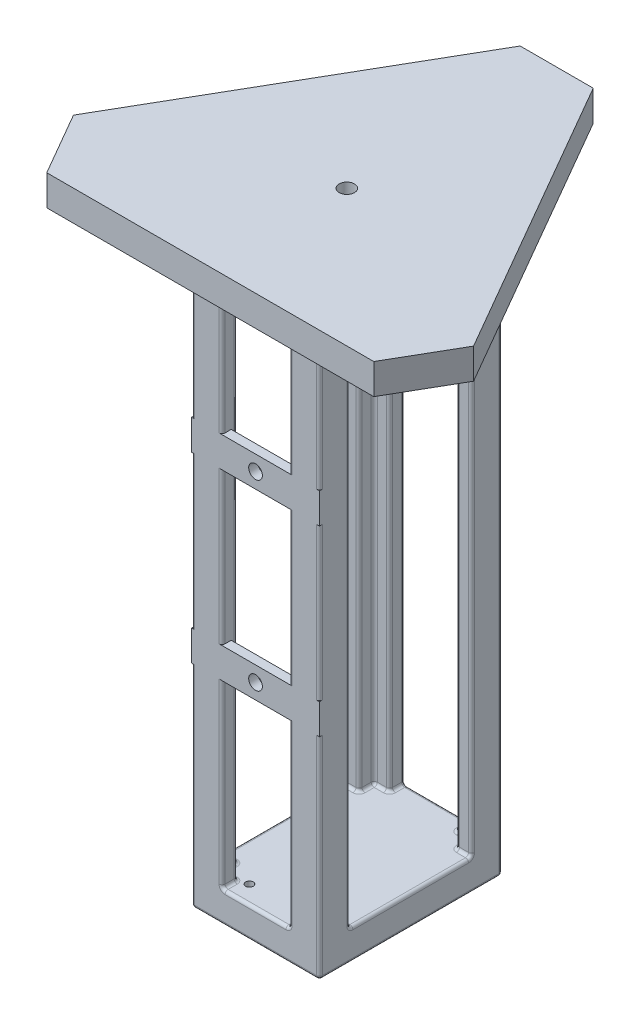
from build123d import *

# Parameters (mm, degrees)
ESQUISSE1_R             = 2.5
BOSS_EXTRU_1_DEPTH      = 5
BOSS_EXTRU_2_DEPTH      = 180
ESQUISSE7_W             = 42
ESQUISSE7_H             = 60
BOSS_EXTRU_3_DEPTH      = 10
CONG_3_R                = 1
ENL_V_MAT_EXTRU_4_REACH = 223.53
ESQUISSE8_R             = 1.25
ESQUISSE12_W            = 42
ESQUISSE12_H            = 10
ESQUISSE12_R            = 2.25
BOSS_EXTRU_5_DEPTH      = 3


with BuildPart() as part:
    # Esquisse1 → Boss.-Extru.1 (new, symmetric)
    with BuildSketch(Plane(origin=(0, 0, 0), x_dir=(1, 0, 0), z_dir=(0, 1, 0))):
        Polygon((-12, 68.963758598), (12, 68.963758598), (65.724366887, -24.089574454), (53.724366887, -44.874184145), (-53.724366887, -44.874184145), (-65.724366887, -24.089574454), align=None)
        Circle(ESQUISSE1_R, mode=Mode.SUBTRACT)
    extrude(amount=BOSS_EXTRU_1_DEPTH, both=True)

    # Esquisse3 → Boss.-Extru.2 (add)
    with BuildSketch(Plane.XZ.offset(5)):
        Polygon((21, 30), (11, 30), (11, 25), (16, 25), (16, 20), (21, 20), align=None)
        Polygon((21, -20), (16, -20), (16, -25), (11, -25), (11, -30), (21, -30), align=None)
        Polygon((-21, -30), (-21, -20), (-16, -20), (-16, -25), (-11, -25), (-11, -30), align=None)
        Polygon((-21, 30), (-21, 20), (-16, 20), (-16, 25), (-11, 25), (-11, 30), align=None)
    extrude(amount=BOSS_EXTRU_2_DEPTH)

    # Esquisse7 → Boss.-Extru.3 (add)
    with BuildSketch(Plane.XZ.offset(185)):
        Rectangle(ESQUISSE7_W, ESQUISSE7_H)
    extrude(amount=BOSS_EXTRU_3_DEPTH)

    # Congé3
    cong_3_edges = [part.edges().sort_by_distance(p)[0] for p in [
        (-18.5, -185, 20),
        (-18.5, -5, 20),
        (-16, -95, 20),
        (-16, -185, 22.5),
        (-16, -5, 22.5),
        (-16, -95, 25),
        (-13.5, -185, 25),
        (-13.5, -5, 25),
        (-11, -95, 25),
        (-11, -185, 27.5),
        (-11, -5, 27.5),
        (18.5, -185, -20),
        (18.5, -5, -20),
        (16, -95, -20),
        (16, -185, -22.5),
        (16, -5, -22.5),
        (16, -95, -25),
        (13.5, -185, -25),
        (13.5, -5, -25),
        (11, -95, -25),
        (11, -185, -27.5),
        (11, -5, -27.5),
        (11, -185, 27.5),
        (11, -5, 27.5),
        (11, -95, 25),
        (13.5, -185, 25),
        (13.5, -5, 25),
        (16, -95, 25),
        (16, -185, 22.5),
        (16, -5, 22.5),
        (16, -95, 20),
        (18.5, -185, 20),
        (18.5, -5, 20),
        (-11, -185, -27.5),
        (-11, -5, -27.5),
        (-11, -95, -25),
        (-13.5, -185, -25),
        (-13.5, -5, -25),
        (-16, -95, -25),
        (-16, -185, -22.5),
        (-16, -5, -22.5),
        (-16, -95, -20),
        (-18.5, -185, -20),
        (-18.5, -5, -20),
        (21, -5, 25),
        (21, -95, 20),
        (21, -95, -20),
        (21, -5, -25),
        (11, -95, -30),
        (-11, -95, -30),
        (-16, -5, -30),
        (21, -100, -30),
        (16, -5, -30),
        (-21, -100, -30),
        (-21, -5, -25),
        (-21, -95, -20),
        (-21, -95, 20),
        (-21, -5, 25),
        (-11, -95, 30),
        (11, -95, 30),
        (16, -5, 30),
        (21, -100, 30),
        (-21, -100, 30),
        (-16, -5, 30),
        (21, -195, 0),
        (21, -185, 0),
        (0, -185, -30),
        (0, -195, -30),
        (-21, -195, 0),
        (-21, -185, 0),
        (0, -185, 30),
        (0, -195, 30),
    ]]
    fillet(cong_3_edges, radius=CONG_3_R)

    # Esquisse8 → Enlèv. mat.-Extru.4 (cut, up to next)
    with BuildSketch(Plane.XZ.offset(195), mode=Mode.PRIVATE) as enl_v_mat_extru_4_sk1:
        with Locations((8, 24)):
            Circle(ESQUISSE8_R)
    enl_v_mat_extru_4_tool1 = extrude(enl_v_mat_extru_4_sk1.sketch, amount=-ENL_V_MAT_EXTRU_4_REACH, mode=Mode.PRIVATE) & part.part
    # Esquisse8 → Enlèv. mat.-Extru.4 (cut, up to next)
    with BuildSketch(Plane.XZ.offset(195), mode=Mode.PRIVATE) as enl_v_mat_extru_4_sk2:
        with Locations((-8, 24)):
            Circle(ESQUISSE8_R)
    enl_v_mat_extru_4_tool2 = extrude(enl_v_mat_extru_4_sk2.sketch, amount=-ENL_V_MAT_EXTRU_4_REACH, mode=Mode.PRIVATE) & part.part
    add(enl_v_mat_extru_4_tool1.solids().sort_by_distance((8, -195, 24))[0], mode=Mode.SUBTRACT)
    add(enl_v_mat_extru_4_tool2.solids().sort_by_distance((-8, -195, 24))[0], mode=Mode.SUBTRACT)

    # Esquisse12 → Boss.-Extru.5 (add)
    # profile 1 of 2: a face of its own
    with BuildSketch(Plane.XY.offset(30)):
        with Locations((0, -60.62)):
            Rectangle(ESQUISSE12_W, ESQUISSE12_H)
        with Locations((0, -60.62)):
            Circle(ESQUISSE12_R, mode=Mode.SUBTRACT)
    # profile 2 of 2: a face of its own
    with BuildSketch(Plane.XY.offset(30)):
        with Locations((0, -120.62)):
            Rectangle(ESQUISSE12_W, ESQUISSE12_H)
        with Locations((0, -120.62)):
            Circle(ESQUISSE12_R, mode=Mode.SUBTRACT)
    extrude(amount=-BOSS_EXTRU_5_DEPTH)


solid = part.part
